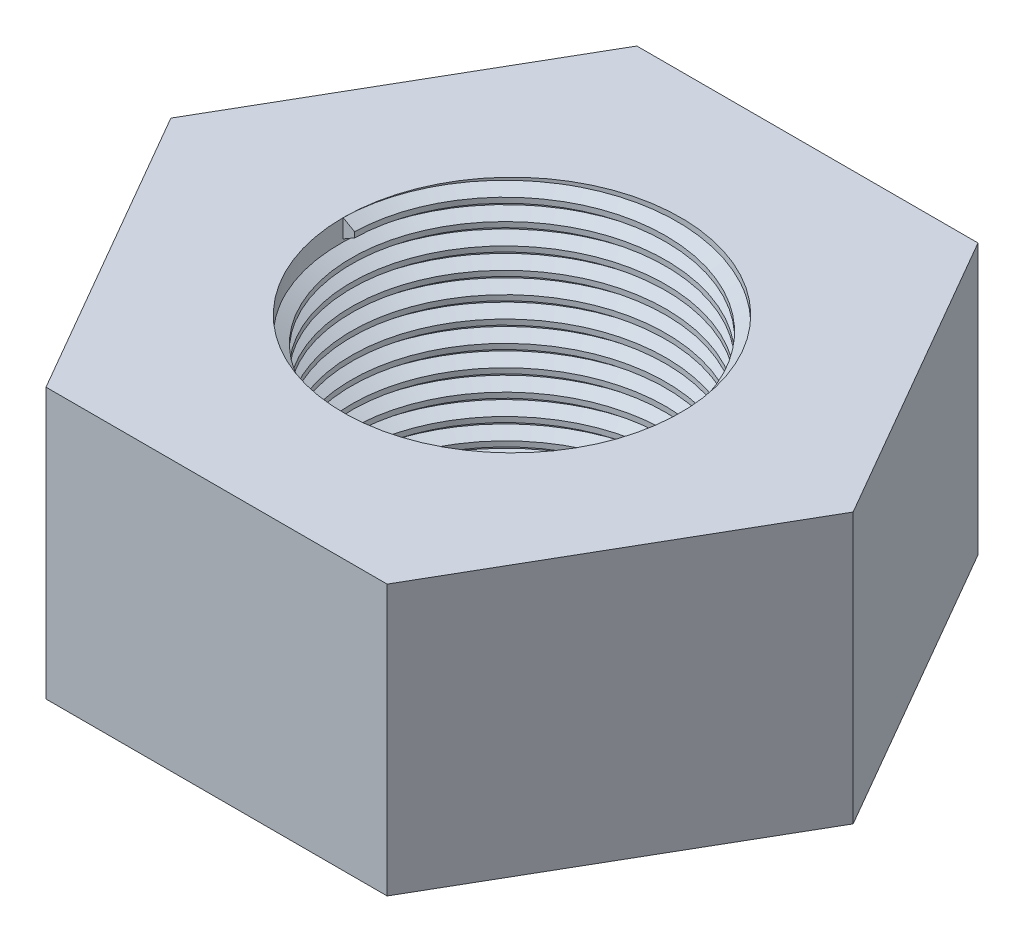
from build123d import *
from build123d.topology import SkipClean

# Parameters (mm, degrees)
AUFSATZ_LINEAR_AUSTRAGEN1_DEPTH = 3.2
SKIZZE2_R                       = 2
SCHNITT_LINEAR_AUSTRAGEN1_DEPTH = 3.2
GEWINDE1_PITCH                  = 0.25


with BuildPart() as part:
    # Skizze1 → Aufsatz-Linear austragen1 (new body)
    with BuildSketch(Plane(origin=(0, 0, 0), x_dir=(1, 0, 0), z_dir=(0, 1, 0))):
        Polygon((4.041451884, 0), (2.020725942, 3.5), (-2.020725942, 3.5), (-4.041451884, 0), (-2.020725942, -3.5), (2.020725942, -3.5), align=None)
    extrude(amount=AUFSATZ_LINEAR_AUSTRAGEN1_DEPTH)

    # Skizze2 → Schnitt-Linear austragen1 (cut)
    with BuildSketch(Plane(origin=(0, 3.2, 0), x_dir=(1, 0, 0), z_dir=(0, 1, 0))):
        with Locations(Location((0, 0, 0), (0, 0, 270))):
            Circle(SKIZZE2_R)
    extrude(amount=-SCHNITT_LINEAR_AUSTRAGEN1_DEPTH, mode=Mode.SUBTRACT)

    # Gewinde1: the profile of Gewindeprofil1 profile screwed along a right-hand helix of 12 turns, 6 arcs to a turn; built about Z, then put on its axis
    with SkipClean():  # the faces are left unmerged after this step: merging them gives an invalid solid
        gewinde1_z = Axis((0, 0, 0), (0, 0, 1))
        gewinde1_corners = [(2.0003, 0, -0.000173205), (2.0003, 0, 0.218923204), (1.864683531, 0, 0.140625), (1.864683531, 0, 0.078125)]
        with BuildLine(mode=Mode.PRIVATE) as gewinde1_profile:
            Line(gewinde1_corners[0], gewinde1_corners[1])
            Line(gewinde1_corners[1], gewinde1_corners[2])
            Line(gewinde1_corners[2], gewinde1_corners[3])
            Line(gewinde1_corners[3], gewinde1_corners[0])
        gewinde1_cap = Face(gewinde1_profile.wire())
        gewinde1_turn_angles = [0, 30, 60, 90, 120, 150, 180, 210, 240, 270, 300, 330, 360]
        gewinde1_turn_weights = [1, 0.8660254037844387, 1, 0.8660254037844387, 1, 0.8660254037844387, 1, 0.8660254037844387, 1, 0.8660254037844387, 1, 0.8660254037844387, 1]
        gewinde1_turn_rails = [Edge.make_bspline([Vector(p[0], p[1], 0).rotate(gewinde1_z, gewinde1_turn_angles[k]) / gewinde1_turn_weights[k] + Vector(0, 0, p[2] + GEWINDE1_PITCH * gewinde1_turn_angles[k] / 360) for k in range(13)], [0, 0, 0, 1, 1, 2, 2, 3, 3, 4, 4, 5, 5, 6, 6, 6], 2, gewinde1_turn_weights) for p in gewinde1_corners]
        gewinde1_turn_sides = [Face.make_surface_from_curves(gewinde1_turn_rails[p[0]], gewinde1_turn_rails[p[1]]) for p in [(0, 1), (1, 2), (2, 3), (3, 0)]]
        gewinde1 = Plane(origin=(0, 3.2, 0), x_dir=(-1, 0, 0), z_dir=(0, -1, 0)) * Solid(Shell([*[p.moved(Location((0, 0, GEWINDE1_PITCH * i))) for i in range(12) for p in gewinde1_turn_sides], gewinde1_cap, gewinde1_cap.rotate(gewinde1_z, 4320).moved(Location((0, 0, GEWINDE1_PITCH * 4320 / 360)))]))
        add(gewinde1)


solid = part.part
